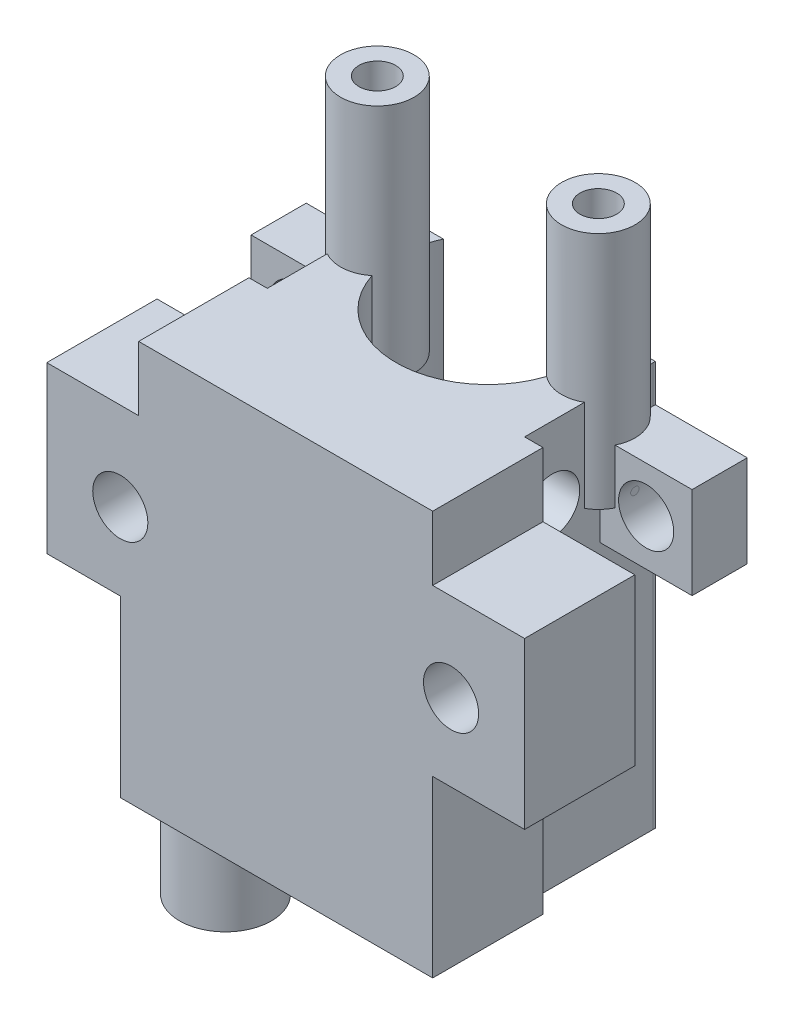
from build123d import *

# Parameters (mm, degrees)
ESBO_O1_R                      = 1.5
RESSALTO_EXTRUS_O1_DEPTH       = 6
ESBO_O6_W                      = 14
ESBO_O6_H                      = 22
RESSALTO_EXTRUS_O3_DEPTH       = 12
ESBO_O7_R                      = 5
CORTE_EXTRUS_O4_DEPTH          = 30.538450843
FILETE3_R                      = 5
RESSALTO_EXTRUS_O13_DEPTH      = 8
RESSALTO_EXTRUS_O13_DEPTH_BACK = 5
ESBO_O15_R                     = 2
ESBO_O17_R                     = 1
CORTE_EXTRUS_O6_DEPTH          = 8
ESBO_O21_W                     = 22.669500521
ESBO_O21_H                     = 31.157259519
CORTE_EXTRUS_O8_DEPTH          = 6
ESBO_O22_W                     = 5
ESBO_O22_H                     = 5
ESBO_O22_R                     = 1.5
RESSALTO_EXTRUS_O15_DEPTH      = 3
ESBO_O23_R                     = 2.5
RESSALTO_EXTRUS_O16_DEPTH      = 5
ESBO_O24_R                     = 0.75
CORTE_EXTRUS_O9_DEPTH          = 5
CHANFRO5_SIZE                  = 1
ESBO_O25_R                     = 1.5
CORTE_EXTRUS_O11_DEPTH         = 14


with BuildPart() as part:
    # Esboço1 → Ressalto-extrusão1 (new body)
    with BuildSketch(Plane.XY):
        Polygon((-11.637137788, -1.832768542), (5.362862212, -1.832768542), (5.362862212, 7.667231458), (10.362862212, 7.667231458), (10.362862212, 16.667231458), (5.362862212, 16.667231458), (5.362862212, 20.167231458), (-10.637137788, 20.167231458), (-10.637137788, 16.667231458), (-15.637137788, 16.667231458), (-15.637137788, 7.667231458), (-11.637137788, 7.667231458), align=None)
        with Locations((6.362862212, 11.867231458)):
            Circle(ESBO_O1_R, mode=Mode.SUBTRACT)
        with Locations((-11.637137788, 11.867231458)):
            Circle(ESBO_O1_R, mode=Mode.SUBTRACT)
    extrude(amount=RESSALTO_EXTRUS_O1_DEPTH)

    # Esboço6 → Ressalto-extrusão3 (add)
    with BuildSketch(Plane(origin=(0, 0, 0), x_dir=(-1, 0, 0), z_dir=(0, 0, -1))):
        with Locations((2.637137788, 9.167231458)):
            Rectangle(ESBO_O6_W, ESBO_O6_H)
    extrude(amount=RESSALTO_EXTRUS_O3_DEPTH)

    # Esboço7 → Corte-extrusão4 (cut, through all)
    with BuildSketch(Plane.XZ.offset(1.832768542)):
        with Locations(Location((-2.637137788, -5, 0), (0, 0, 270))):
            Circle(ESBO_O7_R)
    extrude(amount=-CORTE_EXTRUS_O4_DEPTH, mode=Mode.SUBTRACT)

    # Filete3
    filete3_edges = [part.edges().sort_by_distance(p)[0] for p in [
        (4.362862212, 9.167231458, -12),
        (-9.637137788, 9.167231458, -12),
    ]]
    fillet(filete3_edges, radius=FILETE3_R)

    # Esboço15 → Ressalto-extrusão13 (add, two sides: drawn at the far end of the back side and taken through both)
    with BuildSketch(Plane(origin=(0, 20.167231458, 0), x_dir=(1, 0, 0), z_dir=(0, 1, 0)).offset(-RESSALTO_EXTRUS_O13_DEPTH_BACK)):
        with Locations(Location((-8.650480796, 5, 0), (0, 0, 270))):
            Circle(ESBO_O15_R)
        with Locations(Location((3.376205221, 5, 0), (0, 0, 270))):
            Circle(ESBO_O15_R)
    extrude(amount=RESSALTO_EXTRUS_O13_DEPTH + RESSALTO_EXTRUS_O13_DEPTH_BACK)

    # Esboço17 → Corte-extrusão6 (cut)
    with BuildSketch(Plane(origin=(0, 28.167231458, 0), x_dir=(1, 0, 0), z_dir=(0, 1, 0))):
        with Locations(Location((-8.650480796, 5, 0), (0, 0, 270))):
            Circle(ESBO_O17_R)
        with Locations(Location((3.376205221, 5, 0), (0, 0, 270))):
            Circle(ESBO_O17_R)
    extrude(amount=-CORTE_EXTRUS_O6_DEPTH, mode=Mode.SUBTRACT)

    # Esboço21 → Corte-extrusão8 (cut)
    with BuildSketch(Plane(origin=(0, 0, -7.115225733), x_dir=(1, 0, 0), z_dir=(0, 0, -1))):
        with Locations((-2.778124877, -9.864448806)):
            Rectangle(ESBO_O21_W, ESBO_O21_H)
    extrude(amount=CORTE_EXTRUS_O8_DEPTH, mode=Mode.SUBTRACT)

    # Esboço22 → Ressalto-extrusão15 (add)
    # profile 1 of 2: a face of its own
    with BuildSketch(Plane(origin=(0, 0, -7.115225733), x_dir=(1, 0, 0), z_dir=(0, 0, -1))):
        with Locations((-12.135809914, -15.625880271)):
            Rectangle(ESBO_O22_W, ESBO_O22_H)
        with Locations(Location((-12.135809914, -15.625880271, 0), (0, 0, 180))):
            Circle(ESBO_O22_R, mode=Mode.SUBTRACT)
    # profile 2 of 2: a face of its own
    with BuildSketch(Plane(origin=(0, 0, -7.115225733), x_dir=(1, 0, 0), z_dir=(0, 0, -1))):
        with Locations((6.862862212, -15.625880271)):
            Rectangle(ESBO_O22_W, ESBO_O22_H)
        with Locations(Location((6.862862212, -15.625880271, 0), (0, 0, 180))):
            Circle(ESBO_O22_R, mode=Mode.SUBTRACT)
    extrude(amount=-RESSALTO_EXTRUS_O15_DEPTH)

    # Esboço23 → Ressalto-extrusão16 (add)
    with BuildSketch(Plane.XZ.offset(1.832768542)):
        with Locations(Location((-9.213137788, 2.7, 0), (0, 0, 165.836166317))):
            Circle(ESBO_O23_R)
    extrude(amount=RESSALTO_EXTRUS_O16_DEPTH)

    # Esboço24 → Corte-extrusão9 (cut)
    with BuildSketch(Plane.XZ.offset(6.832768542)):
        with Locations(Location((-9.213137788, 2.7, 0), (0, 0, 270))):
            Circle(ESBO_O24_R)
    extrude(amount=-CORTE_EXTRUS_O9_DEPTH, mode=Mode.SUBTRACT)

    # Chanfro5
    # the kernel refuses this chamfer: 1 mm, written as the material it takes off along each edge
    with BuildSketch(Plane(origin=(6.362862212, 11.867231458, 0), x_dir=(1, 0, 0), z_dir=(0, -1, 0))) as chanfro5_piece_1_section:
        Polygon((1.5 + CHANFRO5_SIZE, 0), (1.5, CHANFRO5_SIZE), (1.5, 0), align=None)
    chanfro5_piece_1 = revolve(axis=Axis((6.362862212, 11.867231458, 0), (0, 0, 1)), mode=Mode.PRIVATE)
    chanfro5_piece_1 = split(chanfro5_piece_1, bisect_by=Plane(origin=(4.362862212, 13.893105183, 0.134898453), z_dir=(1, 0, 0)), keep=Keep.TOP, mode=Mode.PRIVATE)
    add(chanfro5_piece_1, mode=Mode.SUBTRACT)
    with BuildSketch(Plane(origin=(-11.637137788, 11.867231458, 0), x_dir=(1, 0, 0), z_dir=(0, -1, 0))) as chanfro5_piece_2_section:
        Polygon((1.5 + CHANFRO5_SIZE, 0), (1.5, CHANFRO5_SIZE), (1.5, 0), align=None)
    chanfro5_piece_2 = revolve(axis=Axis((-11.637137788, 11.867231458, 0), (0, 0, 1)), mode=Mode.PRIVATE)
    chanfro5_piece_2 = split(chanfro5_piece_2, bisect_by=Plane(origin=(-9.637137788, 11.867231458, 0.487087965), z_dir=(-1, 0, 0)), keep=Keep.TOP, mode=Mode.PRIVATE)
    add(chanfro5_piece_2, mode=Mode.SUBTRACT)

    # Esboço25 → Corte-extrusão11 (cut)
    with BuildSketch(Plane.ZY.offset(9.637137788)):
        with Locations((-1.5, 16.167231458)):
            Circle(ESBO_O25_R)
    extrude(amount=-CORTE_EXTRUS_O11_DEPTH, mode=Mode.SUBTRACT)


solid = part.part
